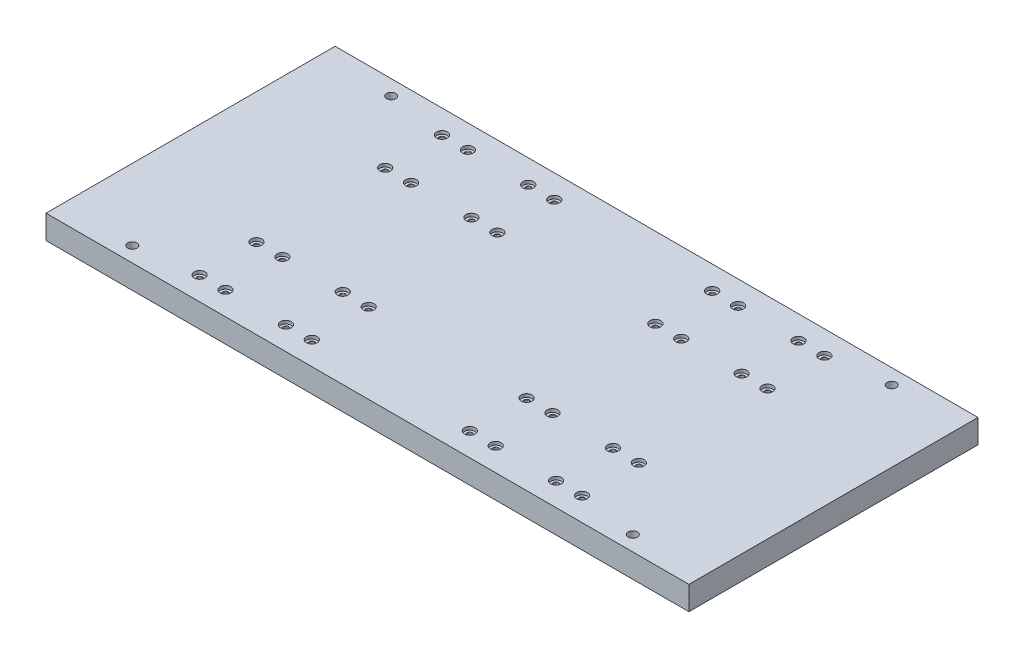
from build123d import *

# Parameters (mm, degrees)
SZKIC1_W                       = 596
SZKIC1_H                       = 268
DODANIE_WYCI_GNI_CIE1_DEPTH    = 22
OTW_R_GWINTOWANY_M101_D        = 8.5
SZKIC7_R                       = 5
SZKIC7_R_2                     = 2.5
WYTNIJ_WYCI_GNI_CIE4_DEPTH     = 3
WYTNIJ_WYCI_GNI_CIE5_OUTLINE_R = 2.5
WYTNIJ_WYCI_GNI_CIE5_DEPTH     = 22
ZAOKR_GLENIE2_R                = 0.3


# Read off the part's stored shape, not the designer's step: Wytnij-wyciągnięcie5
with BuildPart() as part:
    # Szkic1 → Dodanie-wyciągnięcie1 (new body)
    with BuildSketch(Plane(origin=(0, 0, 0), x_dir=(1, 0, 0), z_dir=(0, 1, 0))):
        with Locations((298, 134)):
            Rectangle(SZKIC1_W, SZKIC1_H)
    extrude(amount=DODANIE_WYCI_GNI_CIE1_DEPTH)

    # Otwór gwintowany M101 (through all)
    with Locations(Plane(origin=(66, 22, -254), x_dir=(0, 0, 1), z_dir=(0, 1, 0))):
        with Locations((0, 0), (240, 0), (240, 464), (0, 464)):
            Hole(OTW_R_GWINTOWANY_M101_D / 2)

    # Szkic7 → Wytnij-wyciągnięcie4 (cut)
    # profile 1 of 32: a face of its own
    with BuildSketch(Plane(origin=(0, 22, 0), x_dir=(1, 0, 0), z_dir=(0, 1, 0))):
        with Locations(Location((120.77, 246.35, 0), (0, 0, 270))):
            Circle(SZKIC7_R)
        with Locations(Location((120.77, 246.35, 0), (0, 0, 270))):
            Circle(SZKIC7_R_2, mode=Mode.SUBTRACT)
    # profile 2 of 32: a face of its own
    with BuildSketch(Plane(origin=(0, 22, 0), x_dir=(1, 0, 0), z_dir=(0, 1, 0))):
        with Locations(Location((144.77, 246.35, 0), (0, 0, 270))):
            Circle(SZKIC7_R)
        with Locations(Location((144.77, 246.35, 0), (0, 0, 270))):
            Circle(SZKIC7_R_2, mode=Mode.SUBTRACT)
    # profile 3 of 32: a face of its own
    with BuildSketch(Plane(origin=(0, 22, 0), x_dir=(1, 0, 0), z_dir=(0, 1, 0))):
        with Locations(Location((120.77, 193.65, 0), (0, 0, 270))):
            Circle(SZKIC7_R)
        with Locations(Location((120.77, 193.65, 0), (0, 0, 270))):
            Circle(SZKIC7_R_2, mode=Mode.SUBTRACT)
    # profile 4 of 32: a face of its own
    with BuildSketch(Plane(origin=(0, 22, 0), x_dir=(1, 0, 0), z_dir=(0, 1, 0))):
        with Locations(Location((144.77, 193.65, 0), (0, 0, 270))):
            Circle(SZKIC7_R)
        with Locations(Location((144.77, 193.65, 0), (0, 0, 270))):
            Circle(SZKIC7_R_2, mode=Mode.SUBTRACT)
    # profile 5 of 32: a face of its own
    with BuildSketch(Plane(origin=(0, 22, 0), x_dir=(1, 0, 0), z_dir=(0, 1, 0))):
        with Locations(Location((200.77, 193.65, 0), (0, 0, 270))):
            Circle(SZKIC7_R)
        with Locations(Location((200.77, 193.65, 0), (0, 0, 270))):
            Circle(SZKIC7_R_2, mode=Mode.SUBTRACT)
    # profile 6 of 32: a face of its own
    with BuildSketch(Plane(origin=(0, 22, 0), x_dir=(1, 0, 0), z_dir=(0, 1, 0))):
        with Locations(Location((200.77, 246.35, 0), (0, 0, 270))):
            Circle(SZKIC7_R)
        with Locations(Location((200.77, 246.35, 0), (0, 0, 270))):
            Circle(SZKIC7_R_2, mode=Mode.SUBTRACT)
    # profile 7 of 32: a face of its own
    with BuildSketch(Plane(origin=(0, 22, 0), x_dir=(1, 0, 0), z_dir=(0, 1, 0))):
        with Locations(Location((224.77, 193.65, 0), (0, 0, 270))):
            Circle(SZKIC7_R)
        with Locations(Location((224.77, 193.65, 0), (0, 0, 270))):
            Circle(SZKIC7_R_2, mode=Mode.SUBTRACT)
    # profile 8 of 32: a face of its own
    with BuildSketch(Plane(origin=(0, 22, 0), x_dir=(1, 0, 0), z_dir=(0, 1, 0))):
        with Locations(Location((224.77, 246.35, 0), (0, 0, 270))):
            Circle(SZKIC7_R)
        with Locations(Location((224.77, 246.35, 0), (0, 0, 270))):
            Circle(SZKIC7_R_2, mode=Mode.SUBTRACT)
    # profile 9 of 32: a face of its own
    with BuildSketch(Plane(origin=(0, 22, 0), x_dir=(1, 0, 0), z_dir=(0, 1, 0))):
        with Locations(Location((120.77, 74.35, 0), (0, 0, 270))):
            Circle(SZKIC7_R)
        with Locations(Location((120.77, 74.35, 0), (0, 0, 270))):
            Circle(SZKIC7_R_2, mode=Mode.SUBTRACT)
    # profile 10 of 32: a face of its own
    with BuildSketch(Plane(origin=(0, 22, 0), x_dir=(1, 0, 0), z_dir=(0, 1, 0))):
        with Locations(Location((120.77, 21.65, 0), (0, 0, 270))):
            Circle(SZKIC7_R)
        with Locations(Location((120.77, 21.65, 0), (0, 0, 270))):
            Circle(SZKIC7_R_2, mode=Mode.SUBTRACT)
    # profile 11 of 32: a face of its own
    with BuildSketch(Plane(origin=(0, 22, 0), x_dir=(1, 0, 0), z_dir=(0, 1, 0))):
        with Locations(Location((144.77, 21.65, 0), (0, 0, 270))):
            Circle(SZKIC7_R)
        with Locations(Location((144.77, 21.65, 0), (0, 0, 270))):
            Circle(SZKIC7_R_2, mode=Mode.SUBTRACT)
    # profile 12 of 32: a face of its own
    with BuildSketch(Plane(origin=(0, 22, 0), x_dir=(1, 0, 0), z_dir=(0, 1, 0))):
        with Locations(Location((144.77, 74.35, 0), (0, 0, 270))):
            Circle(SZKIC7_R)
        with Locations(Location((144.77, 74.35, 0), (0, 0, 270))):
            Circle(SZKIC7_R_2, mode=Mode.SUBTRACT)
    # profile 13 of 32: a face of its own
    with BuildSketch(Plane(origin=(0, 22, 0), x_dir=(1, 0, 0), z_dir=(0, 1, 0))):
        with Locations(Location((200.77, 74.35, 0), (0, 0, 270))):
            Circle(SZKIC7_R)
        with Locations(Location((200.77, 74.35, 0), (0, 0, 270))):
            Circle(SZKIC7_R_2, mode=Mode.SUBTRACT)
    # profile 14 of 32: a face of its own
    with BuildSketch(Plane(origin=(0, 22, 0), x_dir=(1, 0, 0), z_dir=(0, 1, 0))):
        with Locations(Location((224.77, 74.35, 0), (0, 0, 270))):
            Circle(SZKIC7_R)
        with Locations(Location((224.77, 74.35, 0), (0, 0, 270))):
            Circle(SZKIC7_R_2, mode=Mode.SUBTRACT)
    # profile 15 of 32: a face of its own
    with BuildSketch(Plane(origin=(0, 22, 0), x_dir=(1, 0, 0), z_dir=(0, 1, 0))):
        with Locations(Location((200.77, 21.65, 0), (0, 0, 270))):
            Circle(SZKIC7_R)
        with Locations(Location((200.77, 21.65, 0), (0, 0, 270))):
            Circle(SZKIC7_R_2, mode=Mode.SUBTRACT)
    # profile 16 of 32: a face of its own
    with BuildSketch(Plane(origin=(0, 22, 0), x_dir=(1, 0, 0), z_dir=(0, 1, 0))):
        with Locations(Location((224.77, 21.65, 0), (0, 0, 270))):
            Circle(SZKIC7_R)
        with Locations(Location((224.77, 21.65, 0), (0, 0, 270))):
            Circle(SZKIC7_R_2, mode=Mode.SUBTRACT)
    # profile 17 of 32: a face of its own
    with BuildSketch(Plane(origin=(0, 22, 0), x_dir=(1, 0, 0), z_dir=(0, 1, 0))):
        with Locations(Location((371.23, 246.35, 0), (0, 0, 270))):
            Circle(SZKIC7_R)
        with Locations(Location((371.23, 246.35, 0), (0, 0, 270))):
            Circle(SZKIC7_R_2, mode=Mode.SUBTRACT)
    # profile 18 of 32: a face of its own
    with BuildSketch(Plane(origin=(0, 22, 0), x_dir=(1, 0, 0), z_dir=(0, 1, 0))):
        with Locations(Location((395.23, 246.35, 0), (0, 0, 270))):
            Circle(SZKIC7_R)
        with Locations(Location((395.23, 246.35, 0), (0, 0, 270))):
            Circle(SZKIC7_R_2, mode=Mode.SUBTRACT)
    # profile 19 of 32: a face of its own
    with BuildSketch(Plane(origin=(0, 22, 0), x_dir=(1, 0, 0), z_dir=(0, 1, 0))):
        with Locations(Location((371.23, 193.65, 0), (0, 0, 270))):
            Circle(SZKIC7_R)
        with Locations(Location((371.23, 193.65, 0), (0, 0, 270))):
            Circle(SZKIC7_R_2, mode=Mode.SUBTRACT)
    # profile 20 of 32: a face of its own
    with BuildSketch(Plane(origin=(0, 22, 0), x_dir=(1, 0, 0), z_dir=(0, 1, 0))):
        with Locations(Location((395.23, 193.65, 0), (0, 0, 270))):
            Circle(SZKIC7_R)
        with Locations(Location((395.23, 193.65, 0), (0, 0, 270))):
            Circle(SZKIC7_R_2, mode=Mode.SUBTRACT)
    # profile 21 of 32: a face of its own
    with BuildSketch(Plane(origin=(0, 22, 0), x_dir=(1, 0, 0), z_dir=(0, 1, 0))):
        with Locations(Location((451.23, 193.65, 0), (0, 0, 270))):
            Circle(SZKIC7_R)
        with Locations(Location((451.23, 193.65, 0), (0, 0, 270))):
            Circle(SZKIC7_R_2, mode=Mode.SUBTRACT)
    # profile 22 of 32: a face of its own
    with BuildSketch(Plane(origin=(0, 22, 0), x_dir=(1, 0, 0), z_dir=(0, 1, 0))):
        with Locations(Location((475.23, 193.65, 0), (0, 0, 270))):
            Circle(SZKIC7_R)
        with Locations(Location((475.23, 193.65, 0), (0, 0, 270))):
            Circle(SZKIC7_R_2, mode=Mode.SUBTRACT)
    # profile 23 of 32: a face of its own
    with BuildSketch(Plane(origin=(0, 22, 0), x_dir=(1, 0, 0), z_dir=(0, 1, 0))):
        with Locations(Location((451.23, 246.35, 0), (0, 0, 270))):
            Circle(SZKIC7_R)
        with Locations(Location((451.23, 246.35, 0), (0, 0, 270))):
            Circle(SZKIC7_R_2, mode=Mode.SUBTRACT)
    # profile 24 of 32: a face of its own
    with BuildSketch(Plane(origin=(0, 22, 0), x_dir=(1, 0, 0), z_dir=(0, 1, 0))):
        with Locations(Location((475.23, 246.35, 0), (0, 0, 270))):
            Circle(SZKIC7_R)
        with Locations(Location((475.23, 246.35, 0), (0, 0, 270))):
            Circle(SZKIC7_R_2, mode=Mode.SUBTRACT)
    # profile 25 of 32: a face of its own
    with BuildSketch(Plane(origin=(0, 22, 0), x_dir=(1, 0, 0), z_dir=(0, 1, 0))):
        with Locations(Location((371.23, 74.35, 0), (0, 0, 270))):
            Circle(SZKIC7_R)
        with Locations(Location((371.23, 74.35, 0), (0, 0, 270))):
            Circle(SZKIC7_R_2, mode=Mode.SUBTRACT)
    # profile 26 of 32: a face of its own
    with BuildSketch(Plane(origin=(0, 22, 0), x_dir=(1, 0, 0), z_dir=(0, 1, 0))):
        with Locations(Location((395.23, 74.35, 0), (0, 0, 270))):
            Circle(SZKIC7_R)
        with Locations(Location((395.23, 74.35, 0), (0, 0, 270))):
            Circle(SZKIC7_R_2, mode=Mode.SUBTRACT)
    # profile 27 of 32: a face of its own
    with BuildSketch(Plane(origin=(0, 22, 0), x_dir=(1, 0, 0), z_dir=(0, 1, 0))):
        with Locations(Location((451.23, 74.35, 0), (0, 0, 270))):
            Circle(SZKIC7_R)
        with Locations(Location((451.23, 74.35, 0), (0, 0, 270))):
            Circle(SZKIC7_R_2, mode=Mode.SUBTRACT)
    # profile 28 of 32: a face of its own
    with BuildSketch(Plane(origin=(0, 22, 0), x_dir=(1, 0, 0), z_dir=(0, 1, 0))):
        with Locations(Location((475.23, 74.35, 0), (0, 0, 270))):
            Circle(SZKIC7_R)
        with Locations(Location((475.23, 74.35, 0), (0, 0, 270))):
            Circle(SZKIC7_R_2, mode=Mode.SUBTRACT)
    # profile 29 of 32: a face of its own
    with BuildSketch(Plane(origin=(0, 22, 0), x_dir=(1, 0, 0), z_dir=(0, 1, 0))):
        with Locations(Location((371.23, 21.65, 0), (0, 0, 270))):
            Circle(SZKIC7_R)
        with Locations(Location((371.23, 21.65, 0), (0, 0, 270))):
            Circle(SZKIC7_R_2, mode=Mode.SUBTRACT)
    # profile 30 of 32: a face of its own
    with BuildSketch(Plane(origin=(0, 22, 0), x_dir=(1, 0, 0), z_dir=(0, 1, 0))):
        with Locations(Location((395.23, 21.65, 0), (0, 0, 270))):
            Circle(SZKIC7_R)
        with Locations(Location((395.23, 21.65, 0), (0, 0, 270))):
            Circle(SZKIC7_R_2, mode=Mode.SUBTRACT)
    # profile 31 of 32: a face of its own
    with BuildSketch(Plane(origin=(0, 22, 0), x_dir=(1, 0, 0), z_dir=(0, 1, 0))):
        with Locations(Location((451.23, 21.65, 0), (0, 0, 270))):
            Circle(SZKIC7_R)
        with Locations(Location((451.23, 21.65, 0), (0, 0, 270))):
            Circle(SZKIC7_R_2, mode=Mode.SUBTRACT)
    # profile 32 of 32: a face of its own
    with BuildSketch(Plane(origin=(0, 22, 0), x_dir=(1, 0, 0), z_dir=(0, 1, 0))):
        with Locations(Location((475.23, 21.65, 0), (0, 0, 270))):
            Circle(SZKIC7_R)
        with Locations(Location((475.23, 21.65, 0), (0, 0, 270))):
            Circle(SZKIC7_R_2, mode=Mode.SUBTRACT)
    extrude(amount=-WYTNIJ_WYCI_GNI_CIE4_DEPTH, mode=Mode.SUBTRACT)

    # Wytnij-wyciągnięcie5 outline → Wytnij-wyciągnięcie5 (cut)
    with BuildSketch(Plane(origin=(0, 0, 0), x_dir=(1, 0, 0), z_dir=(0, 1, 0))):
        with Locations((120.77, 74.35)):
            Circle(WYTNIJ_WYCI_GNI_CIE5_OUTLINE_R)
        with Locations((144.77, 74.35)):
            Circle(WYTNIJ_WYCI_GNI_CIE5_OUTLINE_R)
        with Locations((120.77, 21.65)):
            Circle(WYTNIJ_WYCI_GNI_CIE5_OUTLINE_R)
        with Locations((144.77, 21.65)):
            Circle(WYTNIJ_WYCI_GNI_CIE5_OUTLINE_R)
        with Locations((200.77, 74.35)):
            Circle(WYTNIJ_WYCI_GNI_CIE5_OUTLINE_R)
        with Locations((224.77, 74.35)):
            Circle(WYTNIJ_WYCI_GNI_CIE5_OUTLINE_R)
        with Locations((200.77, 21.65)):
            Circle(WYTNIJ_WYCI_GNI_CIE5_OUTLINE_R)
        with Locations((224.77, 21.65)):
            Circle(WYTNIJ_WYCI_GNI_CIE5_OUTLINE_R)
        with Locations((120.77, 193.65)):
            Circle(WYTNIJ_WYCI_GNI_CIE5_OUTLINE_R)
        with Locations((120.77, 246.35)):
            Circle(WYTNIJ_WYCI_GNI_CIE5_OUTLINE_R)
        with Locations((144.77, 246.35)):
            Circle(WYTNIJ_WYCI_GNI_CIE5_OUTLINE_R)
        with Locations((144.77, 193.65)):
            Circle(WYTNIJ_WYCI_GNI_CIE5_OUTLINE_R)
        with Locations((200.77, 193.65)):
            Circle(WYTNIJ_WYCI_GNI_CIE5_OUTLINE_R)
        with Locations((200.77, 246.35)):
            Circle(WYTNIJ_WYCI_GNI_CIE5_OUTLINE_R)
        with Locations((224.77, 246.35)):
            Circle(WYTNIJ_WYCI_GNI_CIE5_OUTLINE_R)
        with Locations((224.77, 193.65)):
            Circle(WYTNIJ_WYCI_GNI_CIE5_OUTLINE_R)
        with Locations((371.23, 246.35)):
            Circle(WYTNIJ_WYCI_GNI_CIE5_OUTLINE_R)
        with Locations((395.23, 246.35)):
            Circle(WYTNIJ_WYCI_GNI_CIE5_OUTLINE_R)
        with Locations((451.23, 246.35)):
            Circle(WYTNIJ_WYCI_GNI_CIE5_OUTLINE_R)
        with Locations((475.23, 246.35)):
            Circle(WYTNIJ_WYCI_GNI_CIE5_OUTLINE_R)
        with Locations((451.23, 193.65)):
            Circle(WYTNIJ_WYCI_GNI_CIE5_OUTLINE_R)
        with Locations((475.23, 193.65)):
            Circle(WYTNIJ_WYCI_GNI_CIE5_OUTLINE_R)
        with Locations((395.23, 193.65)):
            Circle(WYTNIJ_WYCI_GNI_CIE5_OUTLINE_R)
        with Locations((371.23, 193.65)):
            Circle(WYTNIJ_WYCI_GNI_CIE5_OUTLINE_R)
        with Locations((371.23, 74.35)):
            Circle(WYTNIJ_WYCI_GNI_CIE5_OUTLINE_R)
        with Locations((395.23, 74.35)):
            Circle(WYTNIJ_WYCI_GNI_CIE5_OUTLINE_R)
        with Locations((371.23, 21.65)):
            Circle(WYTNIJ_WYCI_GNI_CIE5_OUTLINE_R)
        with Locations((395.23, 21.65)):
            Circle(WYTNIJ_WYCI_GNI_CIE5_OUTLINE_R)
        with Locations((451.23, 21.65)):
            Circle(WYTNIJ_WYCI_GNI_CIE5_OUTLINE_R)
        with Locations((451.23, 74.35)):
            Circle(WYTNIJ_WYCI_GNI_CIE5_OUTLINE_R)
        with Locations((475.23, 74.35)):
            Circle(WYTNIJ_WYCI_GNI_CIE5_OUTLINE_R)
        with Locations((475.23, 21.65)):
            Circle(WYTNIJ_WYCI_GNI_CIE5_OUTLINE_R)
    extrude(amount=WYTNIJ_WYCI_GNI_CIE5_DEPTH, mode=Mode.SUBTRACT)

    # Zaokrąglenie2
    zaokr_glenie2_edges = [part.edges().sort_by_distance(p)[0] for p in [
        (118.27, 19, -74.35),
        (142.27, 19, -74.35),
        (118.27, 19, -21.65),
        (142.27, 19, -21.65),
        (198.27, 19, -74.35),
        (222.27, 19, -74.35),
        (198.27, 19, -21.65),
        (222.27, 19, -21.65),
        (118.27, 19, -193.65),
        (118.27, 19, -246.35),
        (142.27, 19, -246.35),
        (142.27, 19, -193.65),
        (198.27, 19, -193.65),
        (198.27, 19, -246.35),
        (222.27, 19, -246.35),
        (222.27, 19, -193.65),
        (368.73, 19, -246.35),
        (392.73, 19, -246.35),
        (448.73, 19, -246.35),
        (472.73, 19, -246.35),
        (448.73, 19, -193.65),
        (472.73, 19, -193.65),
        (392.73, 19, -193.65),
        (368.73, 19, -193.65),
        (368.73, 19, -74.35),
        (392.73, 19, -74.35),
        (368.73, 19, -21.65),
        (392.73, 19, -21.65),
        (448.73, 19, -21.65),
        (448.73, 19, -74.35),
        (472.73, 19, -74.35),
        (472.73, 19, -21.65),
    ]]
    fillet(zaokr_glenie2_edges, radius=ZAOKR_GLENIE2_R)


solid = part.part
